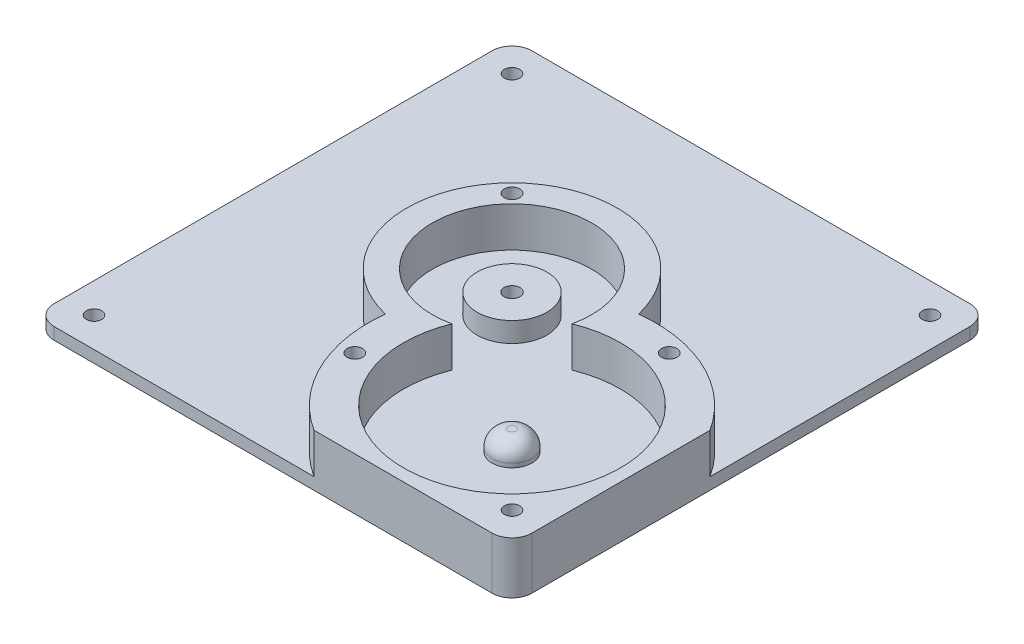
from build123d import *
from build123d.topology import SkipClean

# Parameters (mm, degrees)
SKETCH1_W                    = 152.4
SKETCH1_H                    = 3.81
MAIN_FRAME_DEPTH             = 152.4
FILLET1_R                    = 6.35
SKETCH3_R                    = 6.35
POT_GEAR_SNUB_NUB_DEPTH      = 6.35
SKETCH3_6_R                  = 11.1125
SKETCH3_6_R_2                = 2.54
BASE_SNUB_NUB_DEPTH          = 6.35
SKETCH7_R                    = 2.4384
CORNER_MOUNTING_HOLES_DEPTH  = 216.619670949
FILLET2_R                    = 5.08
F_10_0_1935_DIAMETER_HOLE1_D = 4.9149
BOSS_EXTRUDE2_OUTLINE_R      = 2.45745
BOSS_EXTRUDE2_OUTLINE_R_2    = 2.4384
BOSS_EXTRUDE2_DEPTH          = 12.794


# Read off the part's stored shape, not the designer's step: Boss-Extrude2
with BuildPart() as part:
    # Sketch1 → Main Frame (new body)
    with BuildSketch(Plane(origin=(0, 0, 0), x_dir=(0, 0, -1), z_dir=(1, 0, 0))):
        with Locations((76.2, -1.905)):
            Rectangle(SKETCH1_W, SKETCH1_H)
    extrude(amount=MAIN_FRAME_DEPTH)

    # Fillet1
    fillet1_edges = [part.edges().sort_by_distance(p)[0] for p in [
        (152.4, -1.905, -152.4),
        (152.4, -1.905, 0),
        (0, -1.905, -152.4),
        (0, -1.905, 0),
    ]]
    fillet(fillet1_edges, radius=FILLET1_R)

    # Sketch3 → Pot Gear Snub Nub (add)
    with BuildSketch(Plane(origin=(0, 0, 0), x_dir=(1, 0, 0), z_dir=(0, 1, 0))):
        with Locations(Location((113.917075708, 38.482924292, 0), (0, 0, 90))):
            Circle(SKETCH3_R)
    extrude(amount=POT_GEAR_SNUB_NUB_DEPTH)

    # Sketch3<6> → Base Snub Nub (add)
    with BuildSketch(Plane(origin=(0, 0, 0), x_dir=(1, 0, 0), z_dir=(0, 1, 0))):
        with Locations(Location((76.2, 76.2, 0), (0, 0, 90))):
            Circle(SKETCH3_6_R)
        with Locations(Location((76.2, 76.2, 0), (0, 0, 270))):
            Circle(SKETCH3_6_R_2, mode=Mode.SUBTRACT)
    extrude(amount=BASE_SNUB_NUB_DEPTH)

    # Sketch7 → Corner Mounting Holes (cut, through all)
    with BuildSketch(Plane(origin=(0, 0, 0), x_dir=(1, 0, 0), z_dir=(0, 1, 0))):
        with Locations(Location((142.875, 142.875, 0), (0, 0, 270))):
            Circle(SKETCH7_R)
        with Locations(Location((142.875, 9.525, 0), (0, 0, 270))):
            Circle(SKETCH7_R)
        with Locations(Location((9.525, 9.525, 0), (0, 0, 270))):
            Circle(SKETCH7_R)
        with Locations(Location((9.525, 142.875, 0), (0, 0, 270))):
            Circle(SKETCH7_R)
    extrude(amount=-CORNER_MOUNTING_HOLES_DEPTH, mode=Mode.SUBTRACT)

    # Fillet2
    fillet2_edges = [part.edges().sort_by_distance(p)[0] for p in [
        (113.917075708, 6.35, -32.132924292),
    ]]
    fillet(fillet2_edges, radius=FILLET2_R)

    # #10 (0.1935) Diameter Hole1 (through all)
    with Locations(Plane(origin=(0, 0, 0), x_dir=(1, 0, 0), z_dir=(0, 1, 0))):
        with Locations((124.51641164, 78.040184515), (74.359815485, 27.88358836), (55.344253184, 97.055746816)):
            Hole(F_10_0_1935_DIAMETER_HOLE1_D / 2)

    # Boss-Extrude2 outline → Boss-Extrude2 (add)
    with SkipClean():  # the faces are left unmerged after this step: merging them gives an invalid solid
        with BuildSketch(Plane(origin=(0, 0, 0), x_dir=(1, 0, 0), z_dir=(0, 1, 0))):
            with BuildLine():
                ThreePointArc((108.890253115, 83.92089943), (52.448527028, 99.951472972), (68.47910057, 43.509746885))
                ThreePointArc((68.47910057, 43.509746885), (72.658210549, 18.795756494), (89.240303876, 0))
                Line((89.240303876, 0), (146.05, 0))
                ThreePointArc((146.05, 0), (150.540128061, 1.859871939), (152.4, 6.35))
                Line((152.4, 6.35), (152.4, 63.159696124))
                ThreePointArc((152.4, 63.159696124), (133.604243506, 79.741789451), (108.890253115, 83.92089943))
            make_face()
            with Locations((74.359815485, 27.88358836)):
                Circle(BOSS_EXTRUDE2_OUTLINE_R, mode=Mode.SUBTRACT)
            with Locations((142.875, 9.525)):
                Circle(BOSS_EXTRUDE2_OUTLINE_R_2, mode=Mode.SUBTRACT)
            with BuildLine():
                ThreePointArc((81.82842228, 51.431454168), (58.239487758, 94.160512242), (100.968545832, 70.57157772))
                ThreePointArc((100.968545832, 70.57157772), (138.384871939, 14.015128061), (81.82842228, 51.431454168))
            make_face(mode=Mode.SUBTRACT)
            with Locations((55.344253184, 97.055746816)):
                Circle(BOSS_EXTRUDE2_OUTLINE_R, mode=Mode.SUBTRACT)
            with Locations((124.51641164, 78.040184515)):
                Circle(BOSS_EXTRUDE2_OUTLINE_R, mode=Mode.SUBTRACT)
        extrude(amount=BOSS_EXTRUDE2_DEPTH)


solid = part.part
